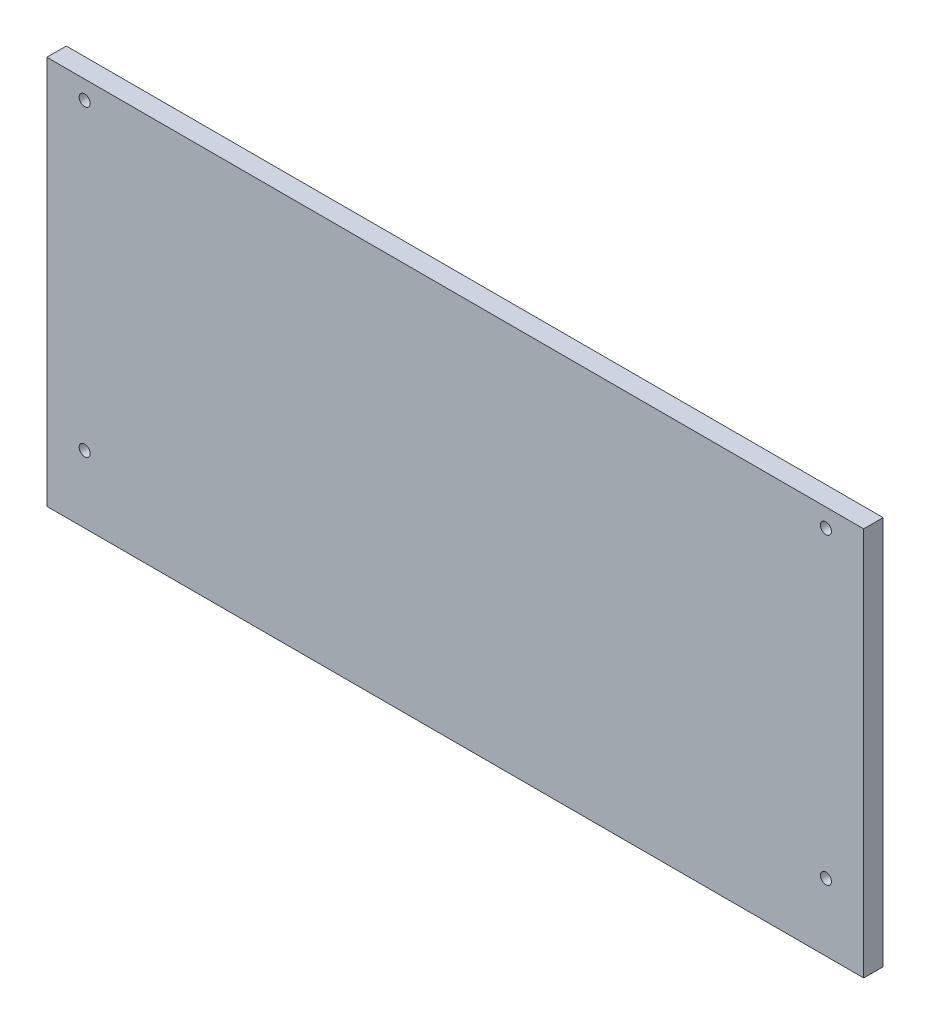
from build123d import *

# Parameters (mm, degrees)
SKETCH1_W            = 266.7
SKETCH1_H            = 127
BOSS_EXTRUDE1_DEPTH  = 6.35
M3_CLEARANCE_HOLE1_D = 3.6


with BuildPart() as part:
    # Sketch1 → Boss-Extrude1 (new body)
    with BuildSketch(Plane.XY):
        with Locations((133.35, 63.5)):
            Rectangle(SKETCH1_W, SKETCH1_H)
    extrude(amount=BOSS_EXTRUDE1_DEPTH)

    # M3 Clearance Hole1 (through all)
    with Locations(Plane.XY.offset(6.35)):
        with Locations((12.3444, 121.0056), (12.3444, 21.9964), (254.3556, 21.9964), (254.3556, 121.0056)):
            Hole(M3_CLEARANCE_HOLE1_D / 2)


solid = part.part
